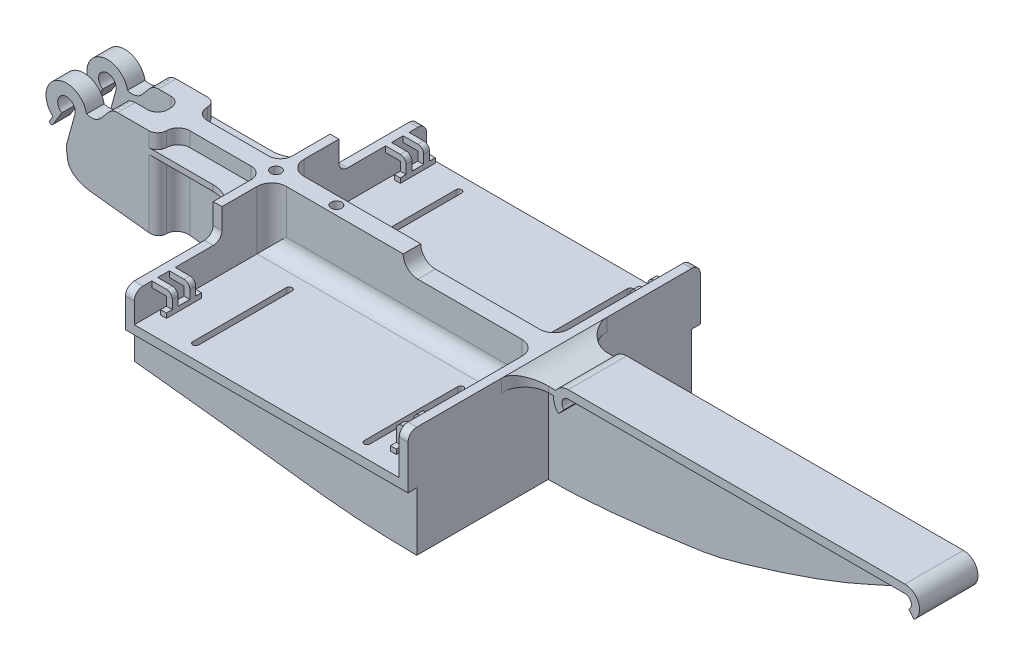
from build123d import *

# Parameters (mm, degrees)
ESTRUSIONE_ESTRUSIONE1_DEPTH       = 50
SCHIZZO2_W                         = 30.000000000000004
SCHIZZO2_H                         = 9.999999999999996
TAGLIO_ESTRUSIONE2_DEPTH           = 3
RACCORDO1_R                        = 3
ESTRUSIONE_ESTRUSIONE2_DEPTH       = 3
RACCORDO1_OF_SPECCHIA1_R           = 3
RACCORDO2_R                        = 5
SCHIZZO4_W                         = 2.000000000000007
SCHIZZO4_H                         = 2.0000000000000036
SCHIZZO4_W_2                       = 2
ESTRUSIONE_ESTRUSIONE3_DEPTH       = 7
SCHIZZO6_W                         = 2
SCHIZZO6_H                         = 2
ESTRUSIONE_ESTRUSIONE5_DEPTH       = 3
SCHIZZO7_W                         = 2
SCHIZZO7_H                         = 12.000000000000007
ESTRUSIONE_ESTRUSIONE6_DEPTH       = 1.62
SCHIZZO8_W                         = 2.000000000000007
SCHIZZO8_H                         = 2
SCHIZZO8_W_2                       = 2
ESTRUSIONE_ESTRUSIONE7_DEPTH       = 7
SCHIZZO9_W                         = 2
SCHIZZO9_H                         = 2.000000000000007
SCHIZZO9_H_2                       = 2
ESTRUSIONE_ESTRUSIONE8_DEPTH       = 4
SCHIZZO10_W                        = 2
SCHIZZO10_H                        = 12.000000000000007
ESTRUSIONE_ESTRUSIONE9_DEPTH       = 1.62
ESTRUSIONE_ESTRUSIONE10_DEPTH      = 20
TAGLIO_ESTRUSIONE3_DEPTH           = 157.55813043006782
RACCORDO3_R                        = 2
ESTRUSIONE_ESTRUSIONE11_DEPTH      = 130
TAGLIO_ESTRUSIONE4_DEPTH           = 257.17730899884293
TAGLIO_ESTRUSIONE5_DEPTH           = 257.17730909601335
ESTRUSIONE_SOTTILE1_START          = -12
ESTRUSIONE_SOTTILE1_DEPTH          = 20
ESTRUSIONE_ESTRUSIONE13_DEPTH      = 4
ESTRUSIONE_ESTRUSIONE14_DEPTH      = 8
ESTRUSIONE_ESTRUSIONE14_DEPTH_BACK = 12
RACCORDO4_START                    = 21.638281439
RACCORDO4_DEPTH                    = 1.921524316
RACCORDO4_START_2                  = 23.559805755
RACCORDO4_2_DEPTH                  = 2.383705051
RACCORDO4_START_3                  = -19
RACCORDO4_3_DEPTH                  = 38
RACCORDO5_R                        = 3
ESTRUSIONE_ESTRUSIONE15_DEPTH      = 35
TAGLIO_ESTRUSIONE6_DEPTH           = 4.999999999999995
ESTRUSIONE_ESTRUSIONE16_DEPTH      = 7
ESTRUSIONE_ESTRUSIONE17_DEPTH      = 30
TAGLIO_ESTRUSIONE7_DEPTH           = 262.4442521514288
ESTRUSIONE_ESTRUSIONE18_DEPTH      = 6
ESTRUSIONE_ESTRUSIONE19_DEPTH      = 6
ESTRUSIONE_ESTRUSIONE20_DEPTH      = 7
RACCORDO6_R                        = 10
RACCORDO7_R                        = 4
RACCORDO8_R                        = 3
RACCORDO9_R                        = 3.5
SPECCHIA3_START                    = -20
SPECCHIA3_DEPTH                    = 17
SPECCHIA3_START_2                  = -10
SPECCHIA3_2_DEPTH                  = 9.44041
SPECCHIA3_START_3                  = -4
SPECCHIA3_3_DEPTH                  = 27.943510702
SPECCHIA3_START_4                  = 23.943510702
SPECCHIA3_4_DEPTH                  = 7
SPECCHIA3_START_5                  = 25.943510702
SPECCHIA3_5_DEPTH                  = 5
TAGLIO_ESTRUSIONE8_DEPTH           = 3
FORO_PER_VITE_M3_1_D               = 3.6
FORO_PER_VITE_M3_1_DEPTH           = 10
FORO_PER_VITE_M3_1_TIP             = 1.0815491142496085


with BuildPart() as part:
    # Schizzo1 → Estrusione-Estrusione1 (new body)
    with BuildSketch(Plane.XY):
        Polygon((25.288328623578938, 10.943510701924849), (25.288328623578938, 30.943510701924847), (22.288328623578938, 30.943510701924847), (22.288328623578938, 7.943510701924847), (118.92832862357893, 7.943510701924859), (118.92832862357892, 25.943510701924858), (115.92832862357893, 25.943510701924858), (115.92832862357893, 10.94351070192486), align=None)
    estrusione_estrusione1 = extrude(amount=ESTRUSIONE_ESTRUSIONE1_DEPTH)

    # Schizzo2 → Taglio-Estrusione2 (cut)
    with BuildSketch(Plane(origin=(25.288328623578938, 0, 0), x_dir=(0, 0, -1), z_dir=(1, 0, 0))):
        with Locations((-35.00000000000001, 25.94351070192485)):
            Rectangle(SCHIZZO2_W, SCHIZZO2_H)
    taglio_estrusione2 = extrude(amount=-TAGLIO_ESTRUSIONE2_DEPTH, mode=Mode.SUBTRACT)

    # Raccordo1
    raccordo1_edges = [part.edges().sort_by_distance(p)[0] for p in [
        (23.788328623578938, 20.94351070192485, 20.000000000000004),
    ]]
    fillet(raccordo1_edges, radius=RACCORDO1_R)

    # Schizzo3 → Estrusione-Estrusione2 (add)
    with BuildSketch(Plane(origin=(0, 0, 0), x_dir=(-1, 0, 0), z_dir=(0, 0, -1))):
        Polygon((-25.288328623578938, 30.943510701924847), (-70.28832862357893, 30.94351070192484), (-70.28832862357893, 25.943510701924858), (-115.92832862357893, 25.943510701924858), (-115.92832862357893, 10.94351070192486), (-25.288328623578938, 10.943510701924849), align=None)
    estrusione_estrusione2 = extrude(amount=-ESTRUSIONE_ESTRUSIONE2_DEPTH)

    # Specchia1: Estrusione-Estrusione1, Taglio-Estrusione2, Estrusione-Estrusione2 across plane
    add(estrusione_estrusione1.mirror(Plane.XY))
    add(taglio_estrusione2.mirror(Plane.XY), mode=Mode.SUBTRACT)
    add(estrusione_estrusione2.mirror(Plane.XY))

    # Raccordo1 of Specchia1
    raccordo1_of_specchia1_edges = [part.edges().sort_by_distance(p)[0] for p in [
        (23.788328623578938, 20.94351070192485, -20.000000000000004),
    ]]
    fillet(raccordo1_of_specchia1_edges, radius=RACCORDO1_OF_SPECCHIA1_R)

    # Raccordo2
    raccordo2_edges = [part.edges().sort_by_distance(p)[0] for p in [
        (70.60832862357893, 10.943510701924854, 3),
        (70.60832862357893, 10.943510701924854, -3),
        (115.92832862357893, 18.443510701924858, -3),
        (115.92832862357893, 18.443510701924858, 3),
        (70.28832862357893, 25.943510701924858, 0),
        (25.288328623578938, 20.94351070192485, -3),
        (25.288328623578938, 20.94351070192485, 3),
    ]]
    fillet(raccordo2_edges, radius=RACCORDO2_R - 0.0001)  # a hair under: the kernel refuses the full size

    # Schizzo4 → Estrusione-Estrusione3 (add)
    with BuildSketch(Plane(origin=(25.288328623578938, 0, 0), x_dir=(0, 0, -1), z_dir=(1, 0, 0))):
        with Locations((-43, 19.94351070192485)):
            Rectangle(SCHIZZO4_W, SCHIZZO4_H)
        with Locations((-37.00000000000001, 19.94351070192485)):
            Rectangle(SCHIZZO4_W_2, SCHIZZO4_H)
    estrusione_estrusione3 = extrude(amount=ESTRUSIONE_ESTRUSIONE3_DEPTH)

    # Schizzo6 → Estrusione-Estrusione5 (add)
    with BuildSketch(Plane.XZ.offset(-18.943510701924847)):
        Polygon((30.288328623578934, 44.000000000000014), (32.288328623578934, 44.00000000000001), (32.288328623578934, 42), (30.288328623578934, 42), align=None)
        with Locations((31.288328623578934, 37.00000000000001)):
            Rectangle(SCHIZZO6_W, SCHIZZO6_H)
    estrusione_estrusione5 = extrude(amount=ESTRUSIONE_ESTRUSIONE5_DEPTH)

    # Schizzo7 → Estrusione-Estrusione6 (add)
    with BuildSketch(Plane.XZ.offset(-15.943510701924849)):
        with Locations((31.288328623578934, 40)):
            Rectangle(SCHIZZO7_W, SCHIZZO7_H)
    estrusione_estrusione6 = extrude(amount=ESTRUSIONE_ESTRUSIONE6_DEPTH)

    # Schizzo8 → Estrusione-Estrusione7 (add)
    with BuildSketch(Plane.ZY.offset(-115.92832862357893)):
        with Locations((43, 19.943510701924858)):
            Rectangle(SCHIZZO8_W, SCHIZZO8_H)
        with Locations((37.00000000000001, 19.943510701924858)):
            Rectangle(SCHIZZO8_W_2, SCHIZZO8_H)
    estrusione_estrusione7 = extrude(amount=ESTRUSIONE_ESTRUSIONE7_DEPTH)

    # Schizzo9 → Estrusione-Estrusione8 (add)
    with BuildSketch(Plane.XZ.offset(-18.943510701924858)):
        with Locations((109.92832862357893, 43)):
            Rectangle(SCHIZZO9_W, SCHIZZO9_H)
        with Locations((109.92832862357893, 37.00000000000001)):
            Rectangle(SCHIZZO9_W, SCHIZZO9_H_2)
    estrusione_estrusione8 = extrude(amount=ESTRUSIONE_ESTRUSIONE8_DEPTH)

    # Schizzo10 → Estrusione-Estrusione9 (add)
    with BuildSketch(Plane.XZ.offset(-14.94351070192486)):
        with Locations((109.92832862357893, 40)):
            Rectangle(SCHIZZO10_W, SCHIZZO10_H)
    estrusione_estrusione9 = extrude(amount=ESTRUSIONE_ESTRUSIONE9_DEPTH)

    # Specchia2: Estrusione-Estrusione3, Estrusione-Estrusione5, Estrusione-Estrusione6, Estrusione-Estrusione7, Estrusione-Estrusione8, Estrusione-Estrusione9 across plane
    add(estrusione_estrusione3.mirror(Plane.XY))
    add(estrusione_estrusione5.mirror(Plane.XY))
    add(estrusione_estrusione6.mirror(Plane.XY))
    add(estrusione_estrusione7.mirror(Plane.XY))
    add(estrusione_estrusione8.mirror(Plane.XY))
    add(estrusione_estrusione9.mirror(Plane.XY))

    # Schizzo11 → Estrusione-Estrusione10 (add)
    with BuildSketch(Plane.XZ.offset(-7.943510701924843)):
        Polygon((22.288328623578938, 47), (118.92832862357893, 47), (118.92832862357893, -47), (22.288328623578938, -47.000000000000014), align=None)
    extrude(amount=ESTRUSIONE_ESTRUSIONE10_DEPTH)

    # Schizzo13 → Taglio-Estrusione3 (cut, through all)
    with BuildSketch(Plane(origin=(6.75e-15, 0, -47.000000000000014), x_dir=(-1, 0, -1.4e-16), z_dir=(1.4e-16, 0, -1))):
        with BuildLine():
            Line((-118.92832862357893, -12.05648929807514), (-22.288328623578934, -12.056489298075153))
            Line((-22.288328623578934, -12.056489298075153), (-22.288328623578934, -2.838486930110436))
            add(Edge.make_bspline(
                [(-118.92832862357893, -12.05648929807514), (-113.32209980371674, -11.960873405897194), (-97.15389628218941, -11.703771958651014), (-74.9046958507149, -8.96886942829054), (-56.98611850606762, -6.650199927824316), (-40.65426945095479, -4.94104978630589), (-29.912378885160106, -3.6877131211147023), (-22.288328623578934, -2.838486930110436)],
                knots=[0, 0, 0, 0, 0.16737759019246348, 0.4820248341138966, 0.6645568864282053, 0.7129153444794661, 0.9656094146265051, 0.9656094146265051, 0.9656094146265051, 0.9656094146265051], degree=3))
        make_face()
    extrude(amount=-TAGLIO_ESTRUSIONE3_DEPTH, mode=Mode.SUBTRACT)

    # Raccordo3
    raccordo3_edges = [part.edges().sort_by_distance(p)[0] for p in [
        (32.288328623578934, 20.94351070192485, 43),
        (32.288328623578934, 20.94351070192485, 37.00000000000001),
        (108.92832862357893, 20.943510701924858, 43),
        (108.92832862357893, 20.943510701924858, 37.00000000000001),
        (32.288328623578934, 20.94351070192485, -43),
        (32.288328623578934, 20.94351070192485, -37.00000000000001),
        (108.92832862357893, 20.943510701924858, -43),
        (108.92832862357893, 20.943510701924858, -37.00000000000001),
    ]]
    fillet(raccordo3_edges, radius=RACCORDO3_R)

    # Schizzo15 → Estrusione-Estrusione11 (add)
    with BuildSketch(Plane(origin=(118.92832862357893, 9.169e-14, 0), x_dir=(0, 0, -1), z_dir=(1, 7.7e-16, 0))):
        Polygon((-2, 25.943510701924772), (-1.9999999999999996, -13.002330305137178), (2.000000000000005, -13.002330305137178), (2.000000000000005, 25.943510701924772), align=None)
    extrude(amount=ESTRUSIONE_ESTRUSIONE11_DEPTH)

    # Schizzo16 → Taglio-Estrusione4 (cut, through all)
    with BuildSketch(Plane.XY.offset(1.9999999999999996)):
        with BuildLine():
            Line((118.92832862357892, -12.05648929807514), (118.92832862357895, -13.002330305137088))
            Line((118.92832862357895, -13.002330305137088), (248.92832862357895, -13.002330305136987))
            Line((248.92832862357895, -13.002330305136987), (252.8557109989531, -13.002330305136995))
            Line((252.8557109989531, -13.002330305136995), (252.8557109989531, 20.26188261583839))
            Line((252.8557109989531, 20.26188261583839), (248.92832862357895, 20.26188261583839))
            add(Edge.make_bspline(
                [(118.92832862357892, -12.05648929807514), (129.632879683741, -12.23905858535709), (148.94628384152014, -10.266430149787162), (174.95168288405276, -6.659110885665116), (178.19171505775452, -5.964494336291254), (202.73332594774783, 1.4454692899883912), (223.44369408188672, 8.74385776444187), (238.83525331857845, 16.62882858425246), (248.92832862357895, 20.26188261583839)],
                knots=[0, 0, 0, 0, 0.25378191641255193, 0.31189796094304456, 0.5512423914869394, 0.6052709398180482, 0.822265390436146, 1, 1, 1, 1], degree=3))
        make_face()
    extrude(amount=-TAGLIO_ESTRUSIONE4_DEPTH, mode=Mode.SUBTRACT)

    # Schizzo18 → Taglio-Estrusione5 (cut, through all)
    with BuildSketch(Plane.XY.offset(1.9999999999999996)):
        Polygon((133.7863166456264, 25.94351070192487), (118.92832862357892, 25.943510701924858), (118.92832862357892, 23.559805855242974), (133.7863166456264, 23.559805855242974), align=None)
    extrude(amount=-TAGLIO_ESTRUSIONE5_DEPTH, mode=Mode.SUBTRACT)

    # Estrusione-Sottile1: read off the stored shape, not the designer's step
    # Estrusione-Sottile1 outline → Estrusione-Sottile1 (add)
    with BuildSketch(Plane.XY.offset(1.9999999999999996).offset(ESTRUSIONE_SOTTILE1_START)):
        with BuildLine():
            ThreePointArc((133.751200449, 25.943510702), (129.0728401, 22.707864533), (130.449487246, 17.188688479))
            Line((130.449487246, 17.188688479), (132.29844664, 19.291388924))
            ThreePointArc((132.29844664, 19.291388924), (131.692721896, 21.719826388), (133.751200449, 23.143510702))
            Line((133.751200449, 23.143510702), (248.928328624, 23.143510702))
            ThreePointArc((248.928328624, 23.143510702), (251.008448923, 21.659820369), (250.282883424, 19.209964829))
            Line((250.282883424, 19.209964829), (252.00686226, 17.003633718))
            ThreePointArc((252.00686226, 17.003633718), (253.655874759, 22.571487219), (248.928328624, 25.943510702))
            Line((248.928328624, 25.943510702), (133.751200449, 25.943510702))
        make_face()
    extrude(amount=ESTRUSIONE_SOTTILE1_DEPTH)

    # Schizzo21 → Estrusione-Estrusione13 (add)
    with BuildSketch(Plane.XY.offset(1.9999999999999996)):
        with BuildLine():
            Line((253.35115182321354, 19.209964829047358), (245.34799317764418, 19.209964829047358))
            ThreePointArc((245.34799317764418, 19.209964829047358), (249.34957250042885, 25.167356575296218), (253.35115182321354, 19.209964829047358))
        make_face()
    extrude(amount=-ESTRUSIONE_ESTRUSIONE13_DEPTH)

    # Schizzo22 → Estrusione-Estrusione14 (add, two sides: drawn at the far end of the back side and taken through both)
    with BuildSketch(Plane.XY.offset(1.9999999999999996).offset(-ESTRUSIONE_ESTRUSIONE14_DEPTH_BACK)):
        with BuildLine():
            Line((118.92832862357892, 25.943510701924858), (118.92832862357892, 21.638281438835815))
            Line((118.92832862357892, 21.638281438835815), (128.95889246790395, 21.638281438835815))
            Line((128.95889246790395, 21.638281438835815), (129.4903320317206, 23.559805855242967))
            add(Edge.make_bspline(
                [(118.92832862357892, 25.943510701924858), (120.38809985316449, 24.87345695796035), (123.90860524233202, 23.57549890473185), (127.61924064308971, 23.564705615178873), (129.4903320317206, 23.559805855242967)],
                knots=[0, 0, 0, 0, 0.4884929383352371, 1, 1, 1, 1], degree=3))
        make_face()
    extrude(amount=ESTRUSIONE_ESTRUSIONE14_DEPTH + ESTRUSIONE_ESTRUSIONE14_DEPTH_BACK)

    # Raccordo4: read off the stored shape, not the designer's step
    # Raccordo4 outline → Raccordo4 (add)
    with BuildSketch(Plane(origin=(0, 0, 0), x_dir=(1, 0, 0), z_dir=(0, 1, 0)).offset(RACCORDO4_START)):
        with BuildLine():
            ThreePointArc((126.928328624, 10), (121.271474375, 12.34314575), (118.928328624, 18))
            Line((118.928328624, 18), (118.928328624, 10))
            Line((118.928328624, 10), (126.928328624, 10))
        make_face()
        with BuildLine():
            Line((118.928328624, -10), (118.928328624, -18))
            ThreePointArc((118.928328624, -18), (121.271474375, -12.34314575), (126.928328624, -10))
            Line((126.928328624, -10), (118.928328624, -10))
        make_face()
    extrude(amount=RACCORDO4_DEPTH)

    # Raccordo4 2 outline → Raccordo4 2 (add)
    with BuildSketch(Plane(origin=(0, 0, 0), x_dir=(1, 0, 0), z_dir=(0, 1, 0)).offset(RACCORDO4_START_2)):
        with BuildLine():
            ThreePointArc((126.928328624, 10), (121.271474375, 12.34314575), (118.928328624, 18))
            Line((118.928328624, 18), (118.928328624, 10))
            Line((118.928328624, 10), (126.928328624, 10))
        make_face()
        with BuildLine():
            Line((118.928328624, -10), (118.928328624, -18))
            ThreePointArc((118.928328624, -18), (121.271474375, -12.34314575), (126.928328624, -10))
            Line((126.928328624, -10), (118.928328624, -10))
        make_face()
    extrude(amount=RACCORDO4_2_DEPTH)

    # Raccordo4 3 outline → Raccordo4 3 (cut)
    with BuildSketch(Plane.XY.offset(RACCORDO4_START_3)):
        with BuildLine():
            add(Edge.make_bspline(
                [(126.928328624, 23.598482748), (125.90336649753036, 23.639363545289314), (123.08974859611634, 23.87739918918125), (120.388099853164, 24.8734569579604), (118.928328624, 25.943510702)],
                knots=[0.2325963336784363, 0.2325963336784363, 0.2325963336784363, 0.2325963336784363, 0.511507061664763, 1, 1, 1, 1], degree=3))
            Line((126.928328624, 23.598482748), (126.928328624, 25.943510806))
            Line((126.928328624, 25.943510806), (118.928328624, 25.943510702))
        make_face()
    extrude(amount=RACCORDO4_3_DEPTH, mode=Mode.SUBTRACT)

    # Raccordo5
    raccordo5_edges = [part.edges().sort_by_distance(p)[0] for p in [
        (23.788328623578938, 20.94351070192485, 50),
        (117.42832862357892, 25.943510701924858, 50),
        (117.42832862357892, 25.943510701924858, -50),
        (23.788328623578938, 20.94351070192485, -50),
    ]]
    fillet(raccordo5_edges, radius=RACCORDO5_R)

    # Schizzo23 → Estrusione-Estrusione15 (add)
    with BuildSketch(Plane.ZY.offset(-22.288328623578938)):
        Polygon((2.999999999999982, 30.943510701924847), (2.9999999999999862, -2.8384869301104376), (-3.0000000000000138, -2.8384869301104385), (-3.000000000000018, 30.943510701924847), align=None)
    extrude(amount=ESTRUSIONE_ESTRUSIONE15_DEPTH)

    # Schizzo24 → Taglio-Estrusione6 (cut, symmetric)
    with BuildSketch(Plane.XY):
        Polygon((22.288328623578927, -2.838486930110436), (-12.711671376421066, 1.0600860941163237), (-12.711671376421066, -2.8384869301104376), align=None)
    extrude(amount=TAGLIO_ESTRUSIONE6_DEPTH, both=True, mode=Mode.SUBTRACT)

    # Schizzo25 → Estrusione-Estrusione16 (add)
    with BuildSketch(Plane.XY.offset(2.999999999999986)):
        Polygon((-6.711671376421065, 30.943510701924847), (-6.711671376421061, 0.39175928996316434), (-12.711671376421066, 1.0600860941163237), (-12.711671376421066, 30.943510701924847), align=None)
    extrude(amount=ESTRUSIONE_ESTRUSIONE16_DEPTH)

    # Schizzo26 → Estrusione-Estrusione17 (add)
    with BuildSketch(Plane.ZY.offset(12.711671376421066)):
        Polygon((3.9999999999999862, 1.0600860941163237), (3.9999999999999862, 30.94351070192485), (9.999999999999986, 30.943510701924847), (9.999999999999986, 1.0600860941163242), align=None)
    extrude(amount=ESTRUSIONE_ESTRUSIONE17_DEPTH)

    # Schizzo27 → Taglio-Estrusione7 (cut, through all)
    with BuildSketch(Plane(origin=(0, 0, 3.9999999999999862), x_dir=(-1, 0, 0), z_dir=(0, 0, -1))):
        with BuildLine():
            Line((20.42967545982026, 30.94351070192485), (54.698915815279086, 30.943510701924854))
            Line((54.698915815279086, 30.943510701924854), (54.69891581527909, 1.0600860941163237))
            Line((54.69891581527909, 1.0600860941163237), (12.711671376421066, 1.0600860941163237))
            Line((12.711671376421066, 1.0600860941163237), (30.562893854237256, 3.048494505587313))
            add(Edge.make_bspline(
                [(30.562893854237256, 3.048494505587313), (34.29452892262058, 3.882066603905664), (37.233304358834346, 5.581294936393832), (37.77700284186207, 10.48108127078394), (38.36594561688845, 13.962773589677733), (35.970823302518966, 16.00167886651656), (34.97586368749933, 17.750300109115333)],
                knots=[0, 0, 0, 0, 0.5293996523212187, 0.5777970202401831, 0.7666781393395938, 1, 1, 1, 1], degree=3))
            Line((34.97586368749933, 17.750300109115333), (31.3502789388216, 25.34613510614334))
            add(Edge.make_bspline(
                [(20.42967545982026, 30.94351070192485), (25.107569166689814, 30.94351070192486), (25.118121936913088, 23.145903797040468), (31.3502789388216, 25.34613510614334)],
                knots=[0, 0, 0, 0, 1, 1, 1, 1], degree=3))
        make_face()
    extrude(amount=-TAGLIO_ESTRUSIONE7_DEPTH, mode=Mode.SUBTRACT)

    # Schizzo28 → Estrusione-Estrusione18 (add)
    with BuildSketch(Plane.XY.offset(9.999999999999986)):
        with BuildLine():
            Line((-37.57999444655505, 13.822668654061998), (-33.95246461971965, 18.16997564039799))
            ThreePointArc((-33.95246461971965, 18.16997564039799), (-38.08518120362355, 30.94133160970732), (-41.57566110758829, 17.979717910105492))
            Line((-41.57566110758829, 17.979717910105492), (-39.4813012931718, 21.387599505430856))
            ThreePointArc((-39.4813012931718, 21.387599505430856), (-39.01159582525097, 26.73414812063518), (-35.017725138035765, 23.148732906864108))
            Line((-35.017725138035765, 23.148732906864108), (-37.57999444655505, 13.822668654061998))
        make_face()
    extrude(amount=-ESTRUSIONE_ESTRUSIONE18_DEPTH)

    # Schizzo29 → Estrusione-Estrusione19 (add)
    with BuildSketch(Plane.XY.offset(9.999999999999986)):
        with BuildLine():
            Line((-41.52140454884265, 18.068002610137533), (-42.5685844560509, 16.364061812474848))
            ThreePointArc((-42.5685844560509, 16.364061812474848), (-43.39392066751218, 16.167033545338494), (-43.590948934648516, 16.992369756799796))
            Line((-43.590948934648516, 16.992369756799796), (-42.54376902744027, 18.69631055446248))
            ThreePointArc((-42.54376902744027, 18.69631055446248), (-41.71843281597899, 18.893338821598817), (-41.52140454884265, 18.068002610137533))
        make_face()
    extrude(amount=-ESTRUSIONE_ESTRUSIONE19_DEPTH)

    # Schizzo30 → Estrusione-Estrusione20 (add)
    with BuildSketch(Plane.XY.offset(2.999999999999986)):
        Polygon((22.288328623578938, 25.943510701924858), (-6.711671376421063, 25.943510701924858), (-6.711671376421061, 23.943510701924847), (22.288328623578938, 23.94351070192485), align=None)
    extrude(amount=ESTRUSIONE_ESTRUSIONE20_DEPTH)

    # Raccordo6
    raccordo6_edges = [part.edges().sort_by_distance(p)[0] for p in [
        (22.288328623578938, 24.943510701924854, 9.999999999999986),
    ]]
    fillet(raccordo6_edges, radius=RACCORDO6_R - 0.0001)  # a hair under: the kernel refuses the full size

    # Raccordo7
    raccordo7_edges = [part.edges().sort_by_distance(p)[0] for p in [
        (22.288328623578938, 10.552511885907204, 2.9999999999999845),
        (-6.711671376421063, 12.167634995944006, 2.999999999999986),
        (-6.711671376421065, 28.44351070192485, 2.999999999999986),
        (22.288328623578938, 28.44351070192485, 2.9999999999999822),
    ]]
    fillet(raccordo7_edges, radius=RACCORDO7_R)

    # Raccordo8
    raccordo8_edges = [part.edges().sort_by_distance(p)[0] for p in [
        (-6.711671376421063, 12.167634995944006, 9.999999999999986),
        (-6.711671376421065, 28.44351070192485, 9.999999999999986),
    ]]
    fillet(raccordo8_edges, radius=RACCORDO8_R - 0.0001)  # a hair under: the kernel refuses the full size

    # Raccordo9
    raccordo9_edges = [part.edges().sort_by_distance(p)[0] for p in [
        (-12.711671376421066, 16.00179839802059, 3.9999999999999862),
    ]]
    fillet(raccordo9_edges, radius=RACCORDO9_R)

    # Specchia3: read off the stored shape, not the designer's step
    # Specchia3 outline → Specchia3 (add)
    with BuildSketch(Plane.XY.offset(SPECCHIA3_START)):
        Polygon((22.288328624, 30.943510702), (-12.711671376, 30.943510702), (-12.711671376, 1.060086094), (22.288328624, -2.83848693), (22.288328624, 23.943510702), (22.288328624, 25.943510702), align=None)
    extrude(amount=SPECCHIA3_DEPTH)

    # Specchia3 2 outline → Specchia3 2 (add)
    with BuildSketch(Plane.XY.offset(SPECCHIA3_START_2)):
        with BuildLine():
            Line((-12.711671376, 30.943510702), (-20.42967546, 30.943510702))
            add(Edge.make_bspline(
                [(-20.42967546, 30.943510702), (-25.026487187982163, 30.9435107019249), (-25.116353890017937, 23.413873134691997), (-31.031763646, 25.240643592)],
                knots=[0, 0, 0, 0, 0.9826669899342586, 0.9826669899342586, 0.9826669899342586, 0.9826669899342586], degree=3))
            ThreePointArc((-31.031763646, 25.240643592), (-41.369964217, 30.028929735), (-42.543769027, 18.696310554))
            Line((-42.543769027, 18.696310554), (-43.590948935, 16.992369757))
            ThreePointArc((-43.590948935, 16.992369757), (-43.393920668, 16.167033545), (-42.568584456, 16.364061812))
            Line((-42.568584456, 16.364061812), (-39.481301293, 21.387599505))
            ThreePointArc((-39.481301293, 21.387599505), (-39.011595826, 26.734148121), (-35.017725138, 23.148732907))
            Line((-35.017725138, 23.148732907), (-37.579994446, 13.822668655))
            add(Edge.make_bspline(
                [(-37.579994446, 13.822668655), (-37.63570638393704, 13.6898353303488), (-38.10157833776042, 12.399895897416638), (-37.7770028418621, 10.4810812707839), (-37.2333043588343, 5.58129493639383), (-34.2945289226206, 3.88206660390566), (-30.562893854, 3.048494506)],
                knots=[0.21124519859674049, 0.21124519859674049, 0.21124519859674049, 0.21124519859674049, 0.233321860660406, 0.422202979759817, 0.470600347678781, 1, 1, 1, 1], degree=3))
            Line((-30.562893854, 3.048494506), (-12.711671376, 1.060086094))
            Line((-12.711671376, 1.060086094), (-12.711671376, 30.943510702))
        make_face()
    extrude(amount=SPECCHIA3_2_DEPTH)

    # Specchia3 3 outline → Specchia3 3 (cut)
    with BuildSketch(Plane(origin=(0, 0, 0), x_dir=(1, 0, 0), z_dir=(0, 1, 0)).offset(SPECCHIA3_START_3)):
        with BuildLine():
            ThreePointArc((18.288328624, 3), (21.116755748, 4.171572875), (22.288328624, 7))
            Line((22.288328624, 7), (22.288328624, 20))
            Line((22.288328624, 20), (-46, 20))
            Line((-46, 20), (-46, 9.999999993))
            Line((-46, 9.999999993), (-9.711671376, 10))
            ThreePointArc((-9.711671376, 10), (-7.590351032, 9.121320344), (-6.711671376, 7))
            ThreePointArc((-6.711671376, 7), (-5.540098501, 4.171572875), (-2.711671376, 3))
            Line((-2.711671376, 3), (18.288328624, 3))
        make_face()
        with BuildLine():
            Line((-16.211671376, 4), (-46, 4))
            Line((-46, 4), (-46, 0.55959))
            Line((-46, 0.55959), (-12.712178694, 0.55959))
            ThreePointArc((-12.712178694, 0.55959), (-13.757956336, 2.99585306), (-16.211671376, 4))
        make_face()
    extrude(amount=SPECCHIA3_3_DEPTH, mode=Mode.SUBTRACT)

    # Specchia3 4 outline → Specchia3 4 (cut)
    with BuildSketch(Plane(origin=(0, 0, 0), x_dir=(1, 0, 0), z_dir=(0, 1, 0)).offset(SPECCHIA3_START_4)):
        with BuildLine():
            ThreePointArc((12.288328624, 10), (19.359396436, 12.928932188), (22.288328624, 20))
            Line((22.288328624, 20), (-46, 20))
            Line((-46, 20), (-46, 9.999999993))
            Line((-46, 9.999999993), (12.288328624, 10))
        make_face()
        with BuildLine():
            Line((-16.211671376, 4), (-46, 4))
            Line((-46, 4), (-46, 0.55959))
            Line((-46, 0.55959), (-12.712178694, 0.55959))
            ThreePointArc((-12.712178694, 0.55959), (-13.757956336, 2.99585306), (-16.211671376, 4))
        make_face()
    extrude(amount=SPECCHIA3_4_DEPTH, mode=Mode.SUBTRACT)

    # Specchia3 5 outline → Specchia3 5 (cut)
    with BuildSketch(Plane(origin=(0, 0, 0), x_dir=(1, 0, 0), z_dir=(0, 1, 0)).offset(SPECCHIA3_START_5)):
        with BuildLine():
            ThreePointArc((18.288328624, 3), (21.116755748, 4.171572875), (22.288328624, 7))
            Line((22.288328624, 7), (22.288328624, 20))
            ThreePointArc((22.288328624, 20), (19.359396436, 12.928932188), (12.288328624, 10))
            Line((12.288328624, 10), (-9.711671376, 10))
            ThreePointArc((-9.711671376, 10), (-7.590351032, 9.121320344), (-6.711671376, 7))
            ThreePointArc((-6.711671376, 7), (-5.540098501, 4.171572875), (-2.711671376, 3))
            Line((-2.711671376, 3), (18.288328624, 3))
        make_face()
    extrude(amount=SPECCHIA3_5_DEPTH, mode=Mode.SUBTRACT)

    # Schizzo33 → Taglio-Estrusione8 (cut)
    with BuildSketch(Plane(origin=(-1.26e-15, 10.943510701924845, 0), x_dir=(1, 1.1e-16, 0), z_dir=(-1.1e-16, 1, 0))):
        with BuildLine():
            Line((42.28832862357894, -13.000000000000002), (42.28832862357894, -45))
            ThreePointArc((42.28832862357894, -45), (41.288328623578934, -46), (40.288328623578934, -45))
            Line((40.288328623578934, -45), (40.288328623578934, -13.000000000000002))
            ThreePointArc((40.288328623578934, -13.000000000000002), (41.288328623578934, -11.999999999999995), (42.28832862357894, -13.000000000000002))
        make_face()
        with BuildLine():
            Line((100.92832862357895, -13.000000000000002), (100.92832862357893, -45))
            ThreePointArc((100.92832862357893, -45), (99.92832862357893, -46), (98.92832862357893, -45))
            Line((98.92832862357893, -45), (98.92832862357892, -13.000000000000002))
            ThreePointArc((98.92832862357892, -13.000000000000002), (99.92832862357893, -11.999999999999988), (100.92832862357895, -13.000000000000002))
        make_face()
    taglio_estrusione8 = extrude(amount=-TAGLIO_ESTRUSIONE8_DEPTH, mode=Mode.SUBTRACT)

    # Specchia4: Taglio-Estrusione8 across plane
    add(taglio_estrusione8.mirror(Plane.XY), mode=Mode.SUBTRACT)

    # Foro per Vite M3-1
    with Locations(Plane(origin=(23.788328624, 30.943510702, 0), x_dir=(0, 0, 1), z_dir=(0, 1, 0))):
        with Locations((0, 0), (0, 20.64)):
            Hole(FORO_PER_VITE_M3_1_D / 2, depth=FORO_PER_VITE_M3_1_DEPTH)
            with Locations((0, 0, -(FORO_PER_VITE_M3_1_DEPTH + FORO_PER_VITE_M3_1_TIP / 2))):  # 118° drill point
                Cone(0, FORO_PER_VITE_M3_1_D / 2, FORO_PER_VITE_M3_1_TIP, mode=Mode.SUBTRACT)


solid = part.part
